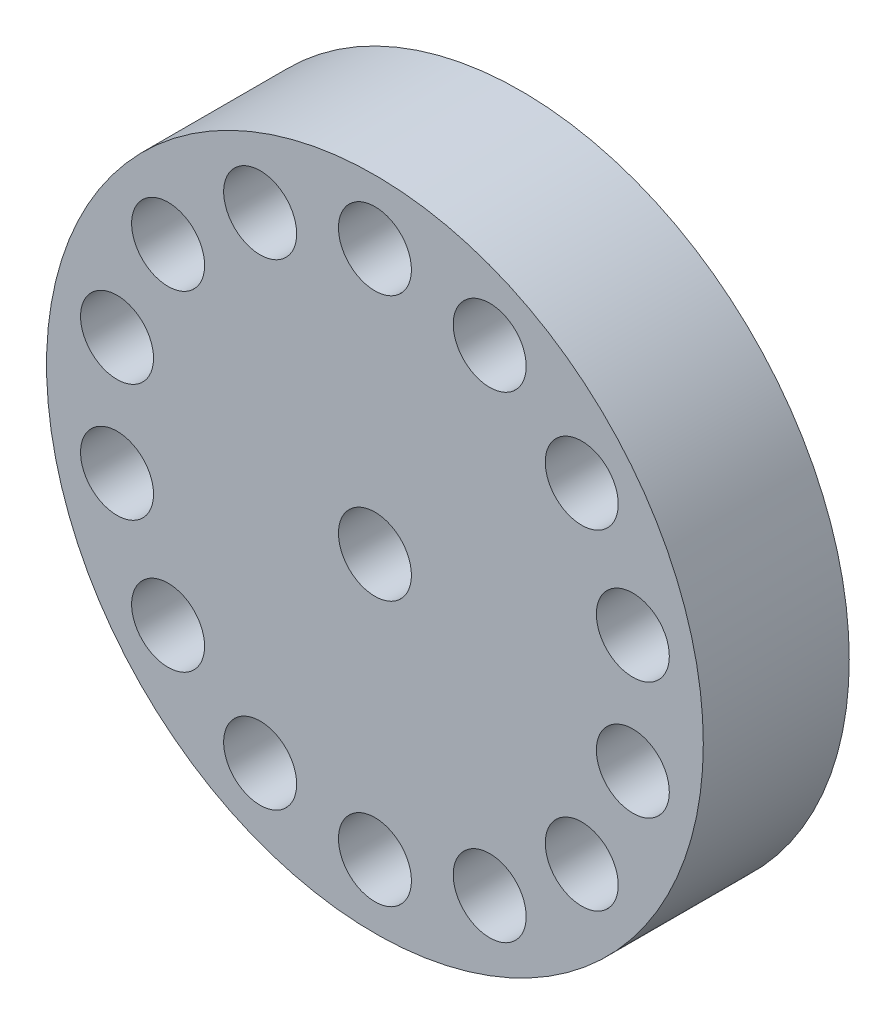
from build123d import *

# Parameters (mm, degrees)
SZKIC1_R                    = 4.5
SZKIC1_R_2                  = 0.5
DODANIE_WYCI_GNI_CIE1_DEPTH = 2
SZKIC2_R                    = 0.5
WYTNIJ_WYCI_GNI_CIE1_DEPTH  = 1


with BuildPart() as part:
    # Szkic1 → Dodanie-wyciągnięcie1 (new body)
    with BuildSketch(Plane.XY):
        Circle(SZKIC1_R)
        Circle(SZKIC1_R_2, mode=Mode.SUBTRACT)
    extrude(amount=DODANIE_WYCI_GNI_CIE1_DEPTH)

    # Szkic2 → Wytnij-wyciągnięcie1 (cut)
    with BuildSketch(Plane.XY.offset(2)):
        with Locations((0, 3.625)):
            Circle(SZKIC2_R)
        with Locations((1.572828554, 3.266012146)):
            Circle(SZKIC2_R)
        with Locations((2.834139124, 2.260150532)):
            Circle(SZKIC2_R)
        with Locations((3.534113682, 0.806638386)):
            Circle(SZKIC2_R)
        with Locations((3.534113682, -0.806638386)):
            Circle(SZKIC2_R)
        with Locations((2.834139124, -2.260150532)):
            Circle(SZKIC2_R)
        with Locations((1.572828554, -3.266012146)):
            Circle(SZKIC2_R)
        with Locations((0, -3.625)):
            Circle(SZKIC2_R)
        with Locations((-1.572828554, -3.266012146)):
            Circle(SZKIC2_R)
        with Locations((-2.834139124, -2.260150532)):
            Circle(SZKIC2_R)
        with Locations((-3.534113682, -0.806638386)):
            Circle(SZKIC2_R)
        with Locations((-3.534113682, 0.806638386)):
            Circle(SZKIC2_R)
        with Locations((-2.834139124, 2.260150532)):
            Circle(SZKIC2_R)
        with Locations((-1.572828554, 3.266012146)):
            Circle(SZKIC2_R)
    extrude(amount=-WYTNIJ_WYCI_GNI_CIE1_DEPTH, mode=Mode.SUBTRACT)


solid = part.part
